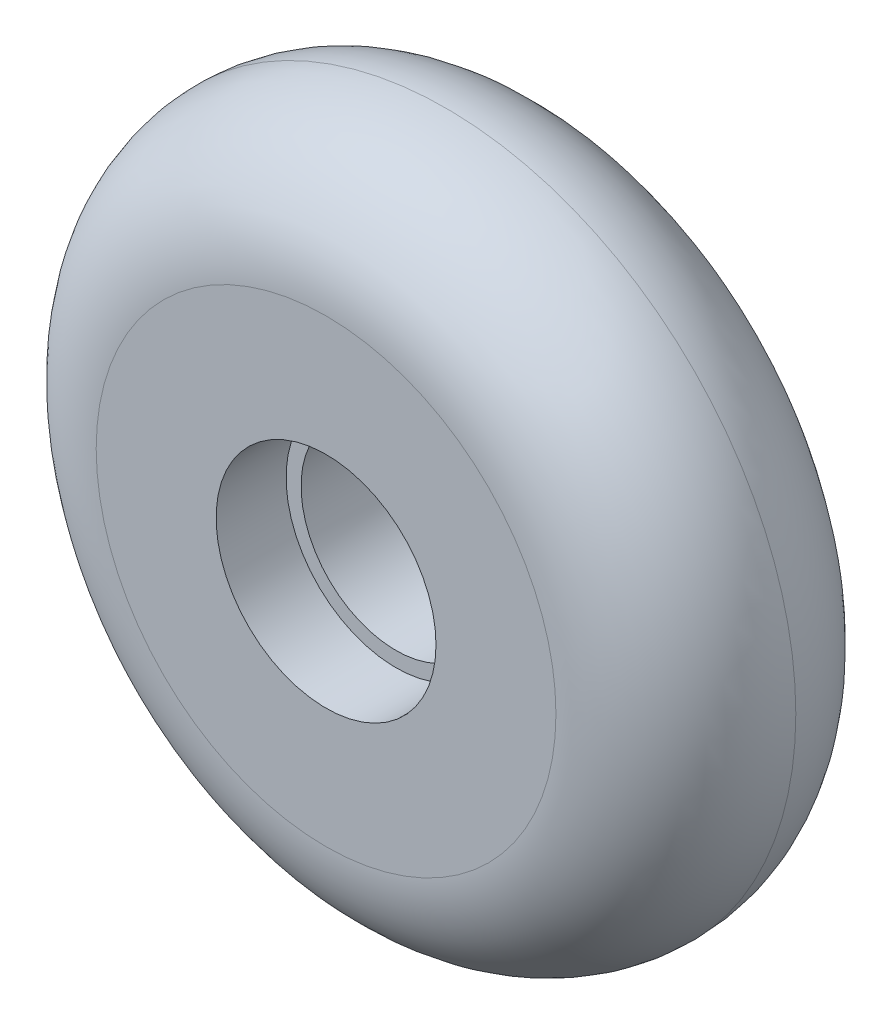
from build123d import *

# Parameters (mm, degrees)
ESQUISSE1_R             = 35
EXTRUSION1_DEPTH        = 24
CONG_1_R                = 12
CONG_2_R                = 12
ESQUISSE2_R             = 11
ENL_V_MAT_EXTRU_1_DEPTH = 7
ENL_V_START             = -7
ESQUISSE3_R             = 11
ENL_V_MAT_EXTRU_2_DEPTH = 7
ESQUISSE5_R             = 9.5
ENL_V_MAT_EXTRU_3_DEPTH = 53.335456499


with BuildPart() as part:
    # Esquisse1 → Extrusion1 (new body)
    with BuildSketch(Plane.XY):
        Circle(ESQUISSE1_R)
    extrude(amount=EXTRUSION1_DEPTH)

    # Congé1
    cong_1_edges = [part.edges().sort_by_distance(p)[0] for p in [
        (-35, 0, 24),
    ]]
    fillet(cong_1_edges, radius=CONG_1_R)

    # Congé2
    cong_2_edges = [part.edges().sort_by_distance(p)[0] for p in [
        (-35, 0, 0),
    ]]
    fillet(cong_2_edges, radius=CONG_2_R - 0.0001)  # a hair under: the kernel refuses the full size

    # Esquisse2 → Enlèv. mat.-Extru.1 (cut)
    with BuildSketch(Plane.XY.offset(24)):
        Circle(ESQUISSE2_R)
    extrude(amount=-ENL_V_MAT_EXTRU_1_DEPTH, mode=Mode.SUBTRACT)

    # Esquisse3 → Enlèv. mat.-Extru.2 (cut)
    with BuildSketch(Plane(origin=(0, 0, 0), x_dir=(-1, 0, 0), z_dir=(0, 0, -1)).offset(ENL_V_START)):
        with Locations(Location((0, 0, 0), (0, 0, 180))):
            Circle(ESQUISSE3_R)
    extrude(amount=ENL_V_MAT_EXTRU_2_DEPTH, mode=Mode.SUBTRACT)

    # Esquisse5 → Enlèv. mat.-Extru.3 (cut, through all)
    with BuildSketch(Plane.XY.offset(17)):
        Circle(ESQUISSE5_R)
    extrude(amount=-ENL_V_MAT_EXTRU_3_DEPTH, mode=Mode.SUBTRACT)


solid = part.part
